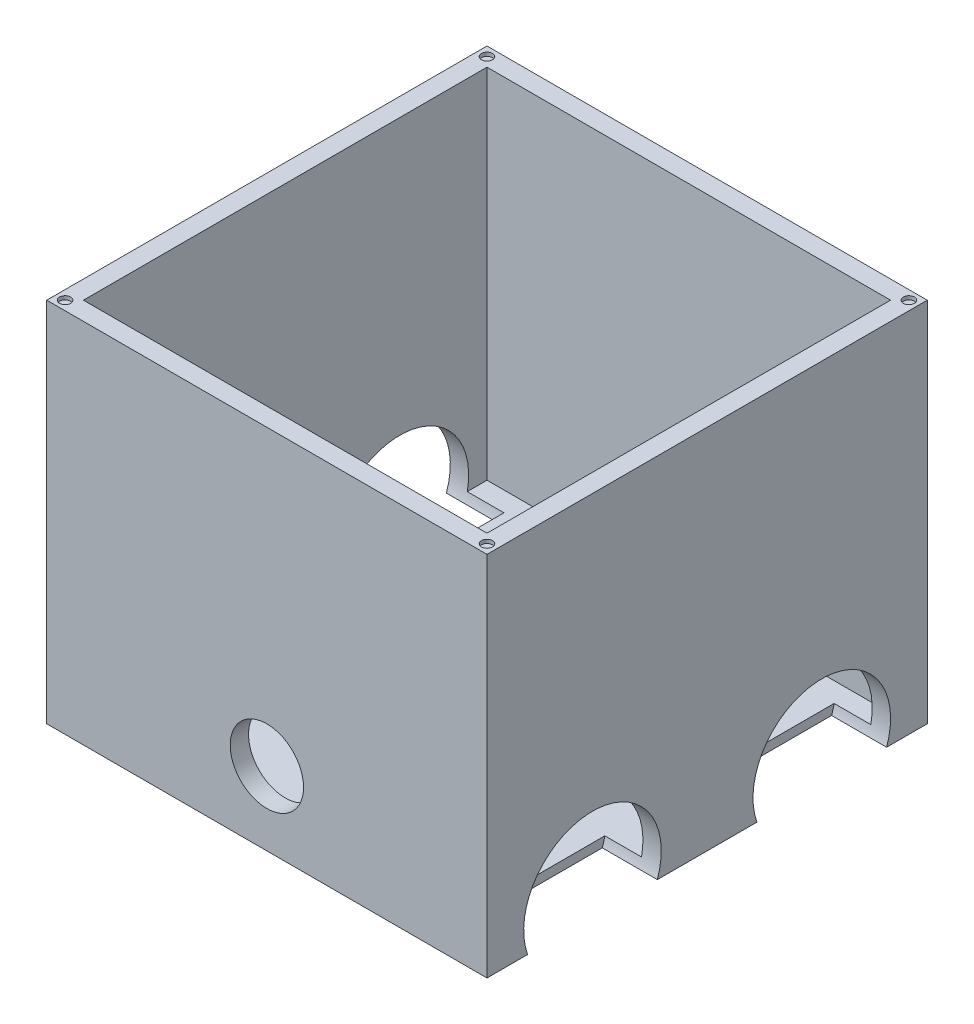
from build123d import *

# Parameters (mm, degrees)
SKETCH2_W           = 240
SKETCH2_H           = 240
BOSS_EXTRUDE1_DEPTH = 200
SKETCH17_W          = 220
SKETCH17_H          = 220
CUT_EXTRUDE1_DEPTH  = 195
SKETCH18_R          = 20
CUT_EXTRUDE2_DEPTH  = 10
SKETCH20_R          = 37.5
CUT_EXTRUDE3_DEPTH  = 30
CUT_EXTRUDE4_START  = -30
SKETCH21_R          = 37.5
CUT_EXTRUDE4_DEPTH  = 30
SKETCH22_R          = 3
CUT_EXTRUDE5_DEPTH  = 2


with BuildPart() as part:
    # Sketch2 → Boss-Extrude1 (new body)
    with BuildSketch(Plane(origin=(0, -113.102021597, 0), x_dir=(1, 0, 0), z_dir=(0, 1, 0))):
        Rectangle(SKETCH2_W, SKETCH2_H)
    extrude(amount=BOSS_EXTRUDE1_DEPTH)

    # Sketch17 → Cut-Extrude1 (cut)
    with BuildSketch(Plane(origin=(0, 86.897978403, 0), x_dir=(1, 0, 0), z_dir=(0, 1, 0))):
        Rectangle(SKETCH17_W, SKETCH17_H)
    extrude(amount=-CUT_EXTRUDE1_DEPTH, mode=Mode.SUBTRACT)

    # Sketch18 → Cut-Extrude2 (cut)
    with BuildSketch(Plane.XY.offset(120)):
        with Locations((0, -73.102021597)):
            Circle(SKETCH18_R)
    extrude(amount=-CUT_EXTRUDE2_DEPTH, mode=Mode.SUBTRACT)

    # Sketch20 → Cut-Extrude3 (cut)
    with BuildSketch(Plane(origin=(120, 0, 0), x_dir=(0, 0, -1), z_dir=(1, 0, 0))):
        with Locations((-62.5, -100.602021597)):
            Circle(SKETCH20_R)
        with Locations((62.5, -100.602021597)):
            Circle(SKETCH20_R)
    extrude(amount=-CUT_EXTRUDE3_DEPTH, mode=Mode.SUBTRACT)

    # Sketch21 → Cut-Extrude4 (cut)
    with BuildSketch(Plane.ZY.offset(120).offset(CUT_EXTRUDE4_START)):
        with Locations((62.5, -100.602021597)):
            Circle(SKETCH21_R)
        with Locations((-62.5, -100.602021597)):
            Circle(SKETCH21_R)
    extrude(amount=CUT_EXTRUDE4_DEPTH, mode=Mode.SUBTRACT)

    # Sketch22 → Cut-Extrude5 (cut)
    with BuildSketch(Plane(origin=(0, 86.897978403, 0), x_dir=(1, 0, 0), z_dir=(0, 1, 0))):
        with Locations((-115, 115)):
            Circle(SKETCH22_R)
        with Locations((-115, -115)):
            Circle(SKETCH22_R)
        with Locations((115, -115)):
            Circle(SKETCH22_R)
        with Locations((115, 115)):
            Circle(SKETCH22_R)
    extrude(amount=-CUT_EXTRUDE5_DEPTH, mode=Mode.SUBTRACT)


solid = part.part
